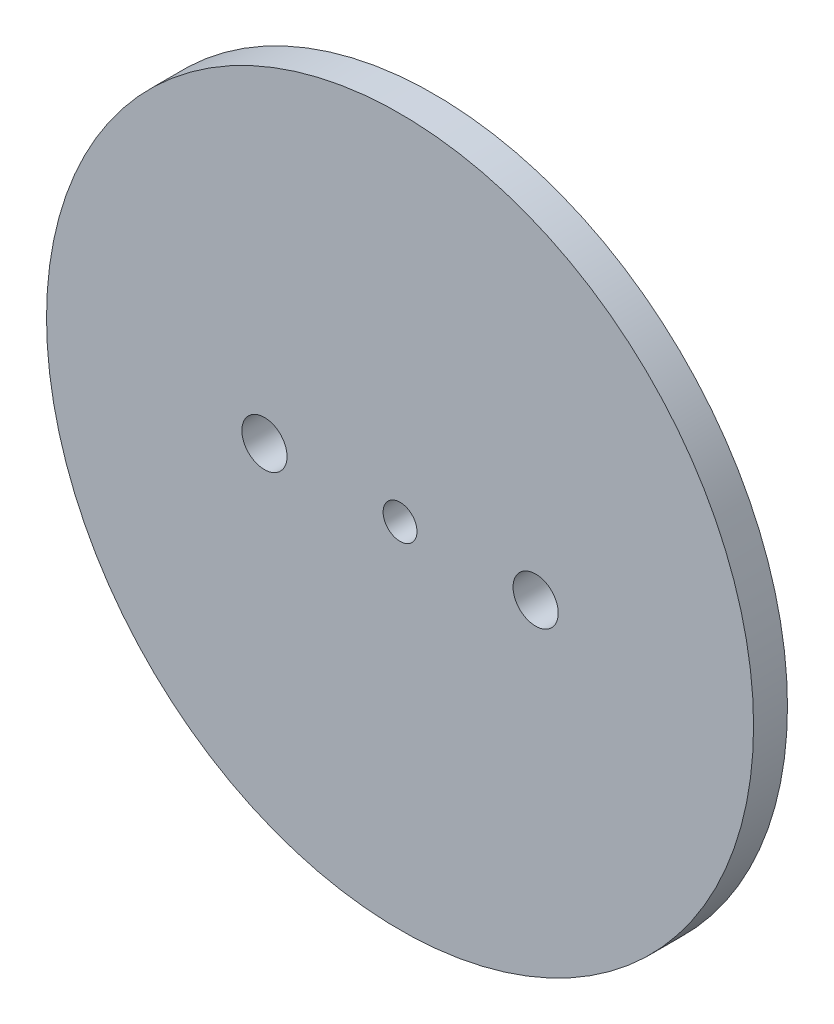
from build123d import *

# Parameters (mm, degrees)
SKETCH1_R           = 49.6697
BOSS_EXTRUDE1_DEPTH = 4.7625
SKETCH2_R           = 2.38125
SKETCH2_R_2         = 3.175
CUT_EXTRUDE1_DEPTH  = 71.404826556


with BuildPart() as part:
    # Sketch1 → Boss-Extrude1 (new body)
    with BuildSketch(Plane.XY):
        Circle(SKETCH1_R)
    extrude(amount=BOSS_EXTRUDE1_DEPTH)

    # Sketch2 → Cut-Extrude1 (cut, through all)
    with BuildSketch(Plane.XY.offset(4.7625)):
        Circle(SKETCH2_R)
        with Locations((19.05, 0)):
            Circle(SKETCH2_R_2)
        with Locations((-19.05, 0)):
            Circle(SKETCH2_R_2)
    extrude(amount=-CUT_EXTRUDE1_DEPTH, mode=Mode.SUBTRACT)


solid = part.part
